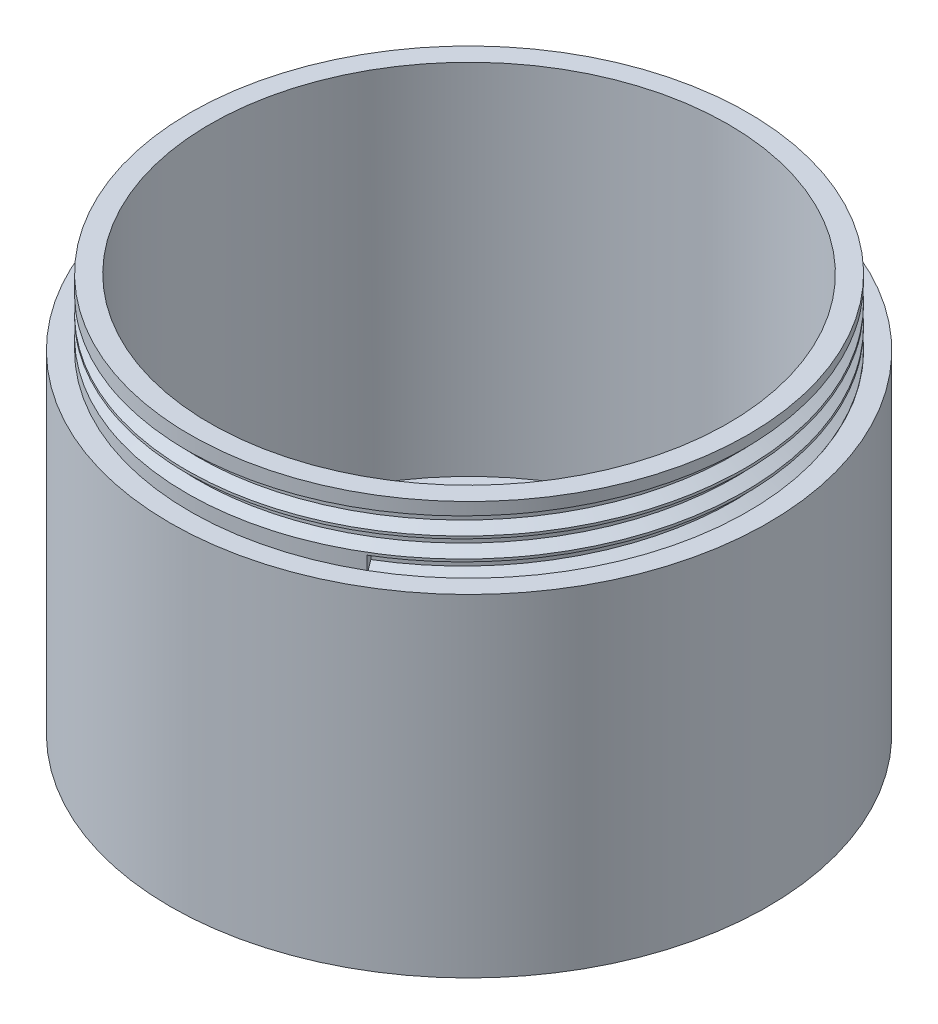
from build123d import *
from build123d.topology import SkipClean

# Parameters (mm, degrees)
SKETCH1_R           = 45
BOSS_EXTRUDE1_DEPTH = 50
SHELL1_T            = -6
SKETCH3_W           = 3
SKETCH3_H           = 10
THREAD1_PITCH       = 3


with BuildPart() as part:
    # Sketch1 → Boss-Extrude1 (new body)
    with BuildSketch(Plane(origin=(0, 0, 0), x_dir=(1, 0, 0), z_dir=(0, 1, 0))):
        with Locations(Location((0, 0, 0), (0, 0, 270))):
            Circle(SKETCH1_R)
    extrude(amount=BOSS_EXTRUDE1_DEPTH)

    # Shell1
    shell1_openings = [part.faces().sort_by_distance(p)[0] for p in [
        (0, 50, 0),
    ]]
    offset(amount=SHELL1_T, openings=shell1_openings, kind=Kind.INTERSECTION)

    # Sketch3 → Revolve1 (revolve)
    with SkipClean():  # the faces are left unmerged after this step: merging them gives an invalid solid
        with BuildSketch(Plane.XY, mode=Mode.PRIVATE) as revolve1_sk:
            with Locations((-40.5, 55)):
                Rectangle(SKETCH3_W, SKETCH3_H)
        revolve(revolve1_sk.sketch.rotate(Axis((0, 0, 0), (0, 1, 0)), 270), axis=Axis((0, 0, 0), (0, 1, 0)))
    add(part.part.scale(1), mode=Mode.REPLACE)  # the faces are merged on a copy

    # Thread1: the profile of Thread Profile1 profile screwed along a right-hand helix of 2.666667 turns, 10 arcs to a turn; built about Z, then put on its axis
    thread1_z = Axis((0, 0, 0), (0, 0, 1))
    thread1_corners = [(42.0003, 0, -0.000173205), (42.0003, 0, 2.625173197), (40.376202375, 0, 1.687499996), (40.376202375, 0, 0.937499996)]
    with BuildLine(mode=Mode.PRIVATE) as thread1_profile:
        Line(thread1_corners[0], thread1_corners[1])
        Line(thread1_corners[1], thread1_corners[2])
        Line(thread1_corners[2], thread1_corners[3])
        Line(thread1_corners[3], thread1_corners[0])
    thread1_cap = Face(thread1_profile.wire())
    thread1_turn_angles = [0, 18, 36, 54, 72, 90, 108, 126, 144, 162, 180, 198, 216, 234, 252, 270, 288, 306, 324, 342, 360]
    thread1_turn_weights = [1, 0.9510565162951535, 1, 0.9510565162951535, 1, 0.9510565162951535, 1, 0.9510565162951535, 1, 0.9510565162951535, 1, 0.9510565162951535, 1, 0.9510565162951535, 1, 0.9510565162951535, 1, 0.9510565162951535, 1, 0.9510565162951535, 1]
    thread1_turn_rails = [Edge.make_bspline([Vector(p[0], p[1], 0).rotate(thread1_z, thread1_turn_angles[k]) / thread1_turn_weights[k] + Vector(0, 0, p[2] + THREAD1_PITCH * thread1_turn_angles[k] / 360) for k in range(21)], [0, 0, 0, 1, 1, 2, 2, 3, 3, 4, 4, 5, 5, 6, 6, 7, 7, 8, 8, 9, 9, 10, 10, 10], 2, thread1_turn_weights) for p in thread1_corners]
    thread1_turn_sides = [Face.make_surface_from_curves(thread1_turn_rails[p[0]], thread1_turn_rails[p[1]]) for p in [(0, 1), (1, 2), (2, 3), (3, 0)]]
    thread1_last_angles = [720, 738, 756, 774, 792, 810, 828, 846, 864, 882, 900, 918, 936, 948, 960]
    thread1_last_weights = [1, 0.9510565162951535, 1, 0.9510565162951535, 1, 0.9510565162951535, 1, 0.9510565162951535, 1, 0.9510565162951535, 1, 0.9510565162951535, 1, 0.978147600733806, 1]
    thread1_last_rails = [Edge.make_bspline([Vector(p[0], p[1], 0).rotate(thread1_z, thread1_last_angles[k]) / thread1_last_weights[k] + Vector(0, 0, p[2] + THREAD1_PITCH * thread1_last_angles[k] / 360) for k in range(15)], [0, 0, 0, 1, 1, 2, 2, 3, 3, 4, 4, 5, 5, 6, 6, 7, 7, 7], 2, thread1_last_weights) for p in thread1_corners]
    thread1_last_sides = [Face.make_surface_from_curves(thread1_last_rails[p[0]], thread1_last_rails[p[1]]) for p in [(0, 1), (1, 2), (2, 3), (3, 0)]]
    thread1 = Plane(origin=(0, 60, 0), x_dir=(-1, 0, 0), z_dir=(0, -1, 0)) * Solid(Shell([*[p.moved(Location((0, 0, THREAD1_PITCH * i))) for i in range(2) for p in thread1_turn_sides], *thread1_last_sides, thread1_cap, thread1_cap.rotate(thread1_z, 960).moved(Location((0, 0, THREAD1_PITCH * 960 / 360)))]))
    add(thread1, mode=Mode.SUBTRACT)


solid = part.part
